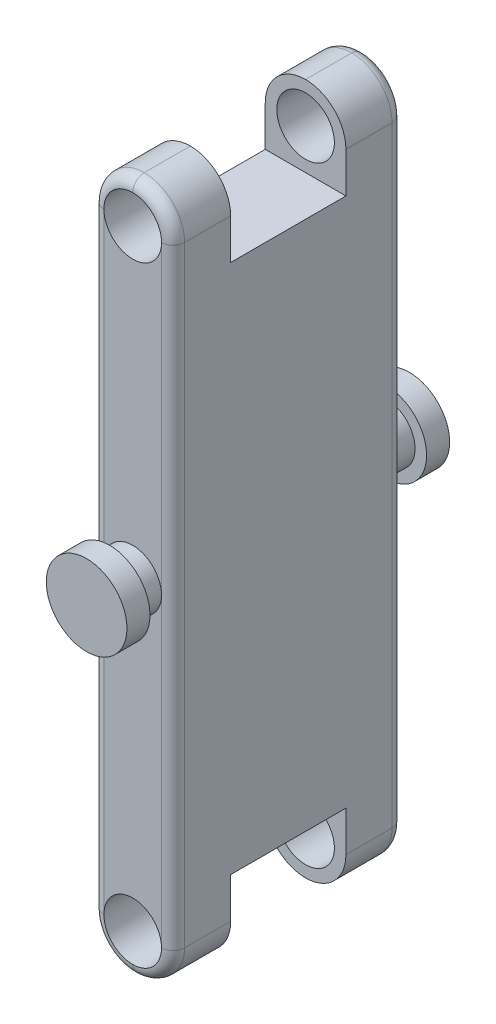
from build123d import *

# Parameters (mm, degrees)
SKETCH1_W           = 14
SKETCH1_H           = 20
BOSS_EXTRUDE1_DEPTH = 120
SKETCH2_W           = 14
SKETCH2_H           = 10
CUT_EXTRUDE1_DEPTH  = 14
SKETCH5_R           = 5
CUT_EXTRUDE4_DEPTH  = 10
SKETCH4_W           = 14
SKETCH4_H           = 10
CUT_EXTRUDE3_DEPTH  = 14
SKETCH6_R           = 5
CUT_EXTRUDE5_DEPTH  = 10
FILLET3_R           = 7
SKETCH7_R           = 5
BOSS_EXTRUDE2_DEPTH = 4
SKETCH8_R           = 7
BOSS_EXTRUDE3_DEPTH = 4
FILLET4_R           = 2


with BuildPart() as part:
    # Sketch1 → Boss-Extrude1 (new body)
    with BuildSketch(Plane(origin=(0, 0, 0), x_dir=(1, 0, 0), z_dir=(0, 1, 0))):
        with Locations((7, -10)):
            Rectangle(SKETCH1_W, SKETCH1_H)
    boss_extrude1 = extrude(amount=BOSS_EXTRUDE1_DEPTH)

    # Sketch2 → Cut-Extrude1 (cut)
    with BuildSketch(Plane.XZ):
        with Locations((7, 5)):
            Rectangle(SKETCH2_W, SKETCH2_H)
    cut_extrude1 = extrude(amount=-CUT_EXTRUDE1_DEPTH, mode=Mode.SUBTRACT)

    # Sketch5 → Cut-Extrude4 (cut)
    with BuildSketch(Plane(origin=(0, 0, 10), x_dir=(-1, 0, 0), z_dir=(0, 0, -1))):
        with Locations((-7, 7)):
            Circle(SKETCH5_R)
    cut_extrude4 = extrude(amount=-CUT_EXTRUDE4_DEPTH, mode=Mode.SUBTRACT)

    # Sketch4 → Cut-Extrude3 (cut)
    with BuildSketch(Plane(origin=(0, 120, 0), x_dir=(1, 0, 0), z_dir=(0, 1, 0))):
        with Locations((7, -5)):
            Rectangle(SKETCH4_W, SKETCH4_H)
    cut_extrude3 = extrude(amount=-CUT_EXTRUDE3_DEPTH, mode=Mode.SUBTRACT)

    # Sketch6 → Cut-Extrude5 (cut)
    with BuildSketch(Plane(origin=(0, 0, 10), x_dir=(-1, 0, 0), z_dir=(0, 0, -1))):
        with Locations((-7, 113)):
            Circle(SKETCH6_R)
    cut_extrude5 = extrude(amount=-CUT_EXTRUDE5_DEPTH, mode=Mode.SUBTRACT)

    # Mirror1: Boss-Extrude1, Cut-Extrude1, Cut-Extrude4, Cut-Extrude3, Cut-Extrude5 across plane
    add(boss_extrude1.mirror(Plane(origin=(0, 120, 0), x_dir=(1, 0, 0), z_dir=(0, 0, 1))))
    add(cut_extrude1.mirror(Plane(origin=(0, 120, 0), x_dir=(1, 0, 0), z_dir=(0, 0, 1))), mode=Mode.SUBTRACT)
    add(cut_extrude4.mirror(Plane(origin=(0, 120, 0), x_dir=(1, 0, 0), z_dir=(0, 0, 1))), mode=Mode.SUBTRACT)
    add(cut_extrude3.mirror(Plane(origin=(0, 120, 0), x_dir=(1, 0, 0), z_dir=(0, 0, 1))), mode=Mode.SUBTRACT)
    add(cut_extrude5.mirror(Plane(origin=(0, 120, 0), x_dir=(1, 0, 0), z_dir=(0, 0, 1))), mode=Mode.SUBTRACT)

    # Fillet3
    fillet3_edges = [part.edges().sort_by_distance(p)[0] for p in [
        (0, 120, -15),
        (14, 120, -15),
        (0, 120, 15),
        (14, 120, 15),
        (0, 0, -15),
        (14, 0, -15),
        (0, 0, 15),
        (14, 0, 15),
    ]]
    fillet(fillet3_edges, radius=FILLET3_R - 0.0001)  # a hair under: the kernel refuses the full size

    # Sketch7 → Boss-Extrude2 (add)
    with BuildSketch(Plane.XY.offset(20)):
        with Locations(Location((7, 60, 0), (0, 0, 180))):
            Circle(SKETCH7_R)
    boss_extrude2 = extrude(amount=BOSS_EXTRUDE2_DEPTH)

    # Sketch8 → Boss-Extrude3 (add)
    with BuildSketch(Plane.XY.offset(24)):
        with Locations((7, 60)):
            Circle(SKETCH8_R)
    boss_extrude3 = extrude(amount=BOSS_EXTRUDE3_DEPTH)

    # Mirror2: Boss-Extrude2, Boss-Extrude3 across plane
    add(boss_extrude2.mirror(Plane.XY))
    add(boss_extrude3.mirror(Plane.XY))

    # Fillet4
    fillet4_edges = [part.edges().sort_by_distance(p)[0] for p in [
        (0, 60, -20),
        (0, 60, 20),
        (14, 60, -20),
        (11.949776758, 2.050223242, -20),
        (2.050223242, 2.050223242, -20),
        (11.949776758, 117.949776758, -20),
        (2.050223242, 117.949776758, -20),
        (14, 60, 20),
        (11.949776758, 2.050223242, 20),
        (2.050223242, 2.050223242, 20),
        (11.949776758, 117.949776758, 20),
        (2.050223242, 117.949776758, 20),
    ]]
    fillet(fillet4_edges, radius=FILLET4_R - 0.0001)  # a hair under: the kernel refuses the full size


solid = part.part
